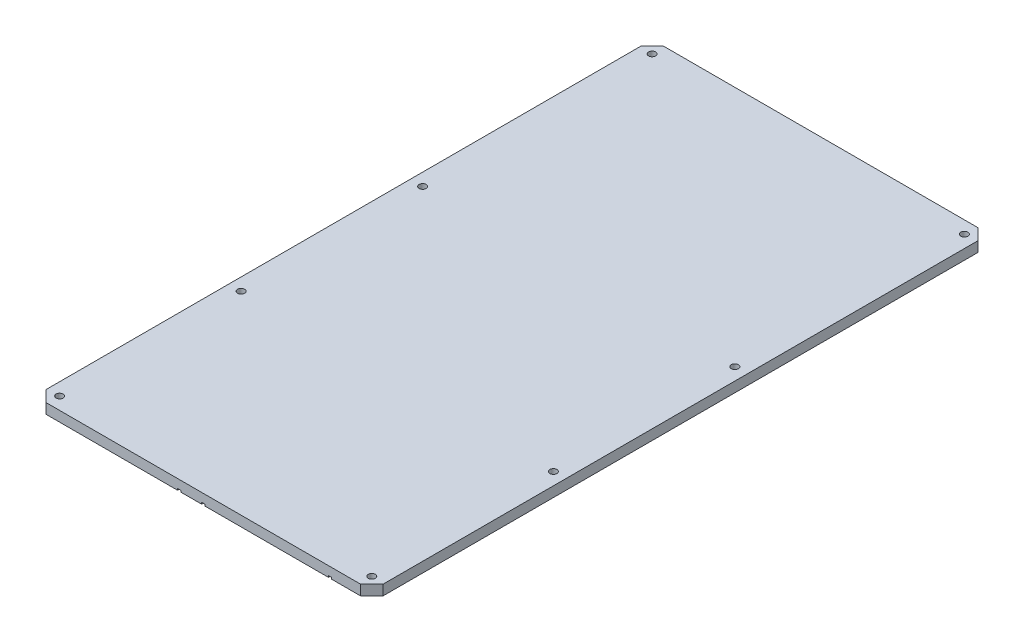
from build123d import *

# Parameters (mm, degrees)
SKETCH1_W               = 105
SKETCH1_H               = 192.3454
BOSS_EXTRUDE1_DEPTH     = 3.175
CHAMFER1_SIZE           = 3.5
SKETCH2_R               = 25
CUT_EXTRUDE1_DEPTH      = 110.615322151
CUT_EXTRUDE_THIN1_START = -0.5
CUT_EXTRUDE_THIN1_DEPTH = 0.5
CUT_EXTRUDE2_DEPTH      = 0.5
SKETCH6_R               = 1.1
CUT_EXTRUDE3_DEPTH      = 110.615322151
CHAMFER2_SIZE           = 1.1
SKETCH7_R               = 25
BOSS_EXTRUDE2_DEPTH     = 3.175
SKETCH7_3_W             = 4
SKETCH7_3_H             = 2
CUT_EXTRUDE4_DEPTH      = 0.5
FILLET1_R               = 0.5


# Read off the part's stored shape, not the designer's step: Cut-Extrude-Thin1
with BuildPart() as part:
    # Sketch1 → Boss-Extrude1 (new body)
    with BuildSketch(Plane(origin=(0, 0, 0), x_dir=(1, 0, 0), z_dir=(0, 1, 0))):
        Rectangle(SKETCH1_W, SKETCH1_H)
    extrude(amount=BOSS_EXTRUDE1_DEPTH)

    # Chamfer1
    chamfer1_edges = [part.edges().sort_by_distance(p)[0] for p in [
        (-52.5, 1.5875, -96.1727),
        (52.5, 1.5875, -96.1727),
        (52.5, 1.5875, 96.1727),
        (-52.5, 1.5875, 96.1727),
    ]]
    chamfer(chamfer1_edges, length=CHAMFER1_SIZE)

    # Sketch2 → Cut-Extrude1 (cut, through all)
    with BuildSketch(Plane.XZ):
        with Locations(Location((0, -32.057566667, 0), (0, 0, 270))):
            Circle(SKETCH2_R)
    extrude(amount=-CUT_EXTRUDE1_DEPTH, mode=Mode.SUBTRACT)

    # Cut-Extrude-Thin1 outline → Cut-Extrude-Thin1 (cut)
    # profile 1 of 2: a face of its own
    with BuildSketch(Plane(origin=(0, 0, 0), x_dir=(-1, 0, 0), z_dir=(0, -1, 0)).offset(CUT_EXTRUDE_THIN1_START)):
        with BuildLine():
            Line((-0.5, 7.062567167), (-0.5, -10.4787141))
            ThreePointArc((-0.5, -10.4787141), (-6.237149669, -19.303333464), (-7.980739941, -29.683539926))
            ThreePointArc((-7.980739941, -29.683539926), (0, -26.804235846), (7.980739941, -29.683539926))
            ThreePointArc((7.980739941, -29.683539926), (6.237149669, -19.303333464), (0.5, -10.4787141))
            Line((0.5, -10.4787141), (0.5, 7.062567167))
            ThreePointArc((0.5, 7.062567167), (0, 7.057566667), (-0.5, 7.062567167))
        make_face()
        with BuildLine():
            ThreePointArc((0, -11.397130906), (5.003923805, -18.927747814), (6.982377972, -27.750171719))
            ThreePointArc((6.982377972, -27.750171719), (0, -25.804235846), (-6.982377972, -27.750171719))
            ThreePointArc((-6.982377972, -27.750171719), (-5.003923805, -18.927747814), (0, -11.397130906))
        make_face(mode=Mode.SUBTRACT)
    # profile 2 of 2: a face of its own
    with BuildSketch(Plane(origin=(0, 0, 0), x_dir=(-1, 0, 0), z_dir=(0, -1, 0)).offset(CUT_EXTRUDE_THIN1_START)):
        with BuildLine():
            ThreePointArc((-3.461538462, -73.83767702), (-2.032623324, -72.965633547), (-0.5, -72.292340123))
            Line((-0.5, -72.292340123), (-0.5, -96.1727))
            Line((-0.5, -96.1727), (0.5, -96.1727))
            Line((0.5, -96.1727), (0.5, -89.050988889))
            Line((0.5, -89.050988889), (5.5, -89.050988889))
            Line((5.5, -89.050988889), (5.5, -88.050988889))
            Line((5.5, -88.050988889), (0.5, -88.050988889))
            Line((0.5, -88.050988889), (0.5, -71.977550364))
            ThreePointArc((0.5, -71.977550364), (3.75, -71.547658069), (7, -71.977550364))
            Line((7, -71.977550364), (7, -96.1727))
            Line((7, -96.1727), (8, -96.1727))
            Line((8, -96.1727), (8, -81.550988889))
            Line((8, -81.550988889), (32.5, -81.550988889))
            Line((32.5, -81.550988889), (32.5, 13.3273))
            Line((32.5, 13.3273), (39, 13.3273))
            Line((39, 13.3273), (39, -88.050988889))
            Line((39, -88.050988889), (9.5, -88.050988889))
            Line((9.5, -88.050988889), (9.5, -89.050988889))
            Line((9.5, -89.050988889), (40, -89.050988889))
            Line((40, -89.050988889), (40, 13.3273))
            Line((40, 13.3273), (43.75, 13.3273))
            Line((43.75, 13.3273), (43.75, 24.3273))
            ThreePointArc((43.75, 24.3273), (41.580951895, 29.804525575), (36.25, 32.311659711))
            Line((36.25, 32.311659711), (36.25, 63.444142327))
            Line((36.25, 63.444142327), (4.25, 63.444142327))
            Line((4.25, 63.444142327), (4.25, 68.752070988))
            ThreePointArc((4.25, 68.752070988), (6.207809813, 67.846319731), (7.980739941, 66.617448963))
            ThreePointArc((7.980739941, 66.617448963), (6.237149669, 76.997655425), (0.5, 85.822274789))
            Line((0.5, 85.822274789), (0.5, 96.1727))
            Line((0.5, 96.1727), (-0.5, 96.1727))
            Line((-0.5, 96.1727), (-0.5, 85.822274789))
            ThreePointArc((-0.5, 85.822274789), (-6.237149669, 76.997655425), (-7.980739941, 66.617448963))
            ThreePointArc((-7.980739941, 66.617448963), (-6.207809813, 67.846319731), (-4.25, 68.752070988))
            Line((-4.25, 68.752070988), (-4.25, 63.444142327))
            Line((-4.25, 63.444142327), (-36.25, 63.444142327))
            Line((-36.25, 63.444142327), (-36.25, 32.311659711))
            ThreePointArc((-36.25, 32.311659711), (-41.580951895, 29.804525575), (-43.75, 24.3273))
            Line((-43.75, 24.3273), (-43.75, 13.3273))
            Line((-43.75, 13.3273), (-40, 13.3273))
            Line((-40, 13.3273), (-40, -96.1727))
            Line((-40, -96.1727), (-39, -96.1727))
            Line((-39, -96.1727), (-39, -38.185855556))
            Line((-39, -38.185855556), (-3.25, -38.185855556))
            Line((-3.25, -38.185855556), (-3.25, -29.234128142))
            ThreePointArc((-3.25, -29.234128142), (0, -28.804235846), (3.25, -29.234128142))
            Line((3.25, -29.234128142), (3.25, -44.685855556))
            Line((3.25, -44.685855556), (-31.5, -44.685855556))
            Line((-31.5, -44.685855556), (-31.5, -39.685855556))
            Line((-31.5, -39.685855556), (-32.5, -39.685855556))
            Line((-32.5, -39.685855556), (-32.5, -45.685855556))
            Line((-32.5, -45.685855556), (3.25, -45.685855556))
            Line((3.25, -45.685855556), (3.25, -53.222136322))
            ThreePointArc((3.25, -53.222136322), (-2.487149669, -62.046755686), (-4.230739941, -72.426962148))
            ThreePointArc((-4.230739941, -72.426962148), (3.75, -69.547658069), (11.730739941, -72.426962148))
            ThreePointArc((11.730739941, -72.426962148), (9.987149669, -62.046755686), (4.25, -53.222136322))
            Line((4.25, -53.222136322), (4.25, -29.548917901))
            ThreePointArc((4.25, -29.548917901), (5.782623324, -30.222211325), (7.211538462, -31.094254798))
            Line((7.211538462, -31.094254798), (7.788461538, -30.277456314))
            ThreePointArc((7.788461538, -30.277456314), (0, -27.804235846), (-7.788461538, -30.277456314))
            Line((-7.788461538, -30.277456314), (-7.211538462, -31.094254798))
            ThreePointArc((-7.211538462, -31.094254798), (-5.782623324, -30.222211325), (-4.25, -29.548917901))
            Line((-4.25, -29.548917901), (-4.25, -37.185855556))
            Line((-4.25, -37.185855556), (-39, -37.185855556))
            Line((-39, -37.185855556), (-39, 13.3273))
            Line((-39, 13.3273), (-32.5, 13.3273))
            Line((-32.5, 13.3273), (-32.5, -35.685855556))
            Line((-32.5, -35.685855556), (-31.5, -35.685855556))
            Line((-31.5, -35.685855556), (-31.5, 13.3273))
            Line((-31.5, 13.3273), (-27.75, 13.3273))
            Line((-27.75, 13.3273), (-27.75, 24.3273))
            ThreePointArc((-27.75, 24.3273), (-29.919048105, 29.804525575), (-35.25, 32.311659711))
            Line((-35.25, 32.311659711), (-35.25, 62.444142327))
            Line((-35.25, 62.444142327), (-3.25, 62.444142327))
            Line((-3.25, 62.444142327), (-3.25, 69.066860747))
            ThreePointArc((-3.25, 69.066860747), (0, 69.496753043), (3.25, 69.066860747))
            Line((3.25, 69.066860747), (3.25, 62.444142327))
            Line((3.25, 62.444142327), (35.25, 62.444142327))
            Line((35.25, 62.444142327), (35.25, 32.311659711))
            ThreePointArc((35.25, 32.311659711), (29.919048105, 29.804525575), (27.75, 24.3273))
            Line((27.75, 24.3273), (27.75, 13.3273))
            Line((27.75, 13.3273), (31.5, 13.3273))
            Line((31.5, 13.3273), (31.5, -80.550988889))
            Line((31.5, -80.550988889), (8, -80.550988889))
            Line((8, -80.550988889), (8, -72.292340123))
            ThreePointArc((8, -72.292340123), (9.532623324, -72.965633547), (10.961538462, -73.83767702))
            Line((10.961538462, -73.83767702), (11.538461538, -73.020878536))
            ThreePointArc((11.538461538, -73.020878536), (3.75, -70.547658069), (-4.038461538, -73.020878536))
            Line((-4.038461538, -73.020878536), (-3.461538462, -73.83767702))
        make_face()
        with BuildLine():
            ThreePointArc((3.75, -54.140553128), (8.753923805, -61.671170036), (10.732377972, -70.493593942))
            ThreePointArc((10.732377972, -70.493593942), (3.75, -68.547658069), (-3.232377972, -70.493593942))
            ThreePointArc((-3.232377972, -70.493593942), (-1.253923805, -61.671170036), (3.75, -54.140553128))
        make_face(mode=Mode.SUBTRACT)
        with BuildLine():
            Line((-28.75, 14.3273), (-42.75, 14.3273))
            Line((-42.75, 14.3273), (-42.75, 24.3273))
            ThreePointArc((-42.75, 24.3273), (-35.75, 31.3273), (-28.75, 24.3273))
            Line((-28.75, 24.3273), (-28.75, 14.3273))
        make_face(mode=Mode.SUBTRACT)
        with BuildLine():
            ThreePointArc((28.75, 24.3273), (35.75, 31.3273), (42.75, 24.3273))
            Line((42.75, 24.3273), (42.75, 14.3273))
            Line((42.75, 14.3273), (28.75, 14.3273))
            Line((28.75, 14.3273), (28.75, 24.3273))
        make_face(mode=Mode.SUBTRACT)
        with BuildLine():
            ThreePointArc((0, 84.903857983), (5.003923805, 77.373241075), (6.982377972, 68.55081717))
            ThreePointArc((6.982377972, 68.55081717), (0, 70.496753043), (-6.982377972, 68.55081717))
            ThreePointArc((-6.982377972, 68.55081717), (-5.003923805, 77.373241075), (0, 84.903857983))
        make_face(mode=Mode.SUBTRACT)
    extrude(amount=CUT_EXTRUDE_THIN1_DEPTH, mode=Mode.SUBTRACT)

    # Sketch4 → Cut-Extrude2 (cut)
    with BuildSketch(Plane.XZ):
        with BuildLine():
            Line((-10.5, 88.050988889), (-9.5, 88.050988889))
            ThreePointArc((-9.5, 88.050988889), (-7.5, 86.050988889), (-5.5, 88.050988889))
            Line((-5.5, 88.050988889), (-4.5, 88.050988889))
            ThreePointArc((-4.5, 88.050988889), (-7.5, 85.050988889), (-10.5, 88.050988889))
        make_face()
        with BuildLine():
            Line((31.5, 35.685855556), (31.5, 34.685855556))
            ThreePointArc((31.5, 34.685855556), (28.5, 37.685855556), (31.5, 40.685855556))
            Line((31.5, 40.685855556), (31.5, 39.685855556))
            ThreePointArc((31.5, 39.685855556), (29.5, 37.685855556), (31.5, 35.685855556))
        make_face()
    extrude(amount=-CUT_EXTRUDE2_DEPTH, mode=Mode.SUBTRACT)

    # Sketch6 → Cut-Extrude3 (cut, through all)
    with BuildSketch(Plane.XZ):
        with Locations(Location((48.628679656, -20.801379656, 0), (0, 0, 270))):
            Circle(SKETCH6_R)
        with Locations(Location((-48.628679656, 92.301379656, 0), (0, 0, 270))):
            Circle(SKETCH6_R)
        with Locations(Location((-48.628679656, 35.75, 0), (0, 0, 270))):
            Circle(SKETCH6_R)
        with Locations(Location((-48.628679656, -20.801379656, 0), (0, 0, 270))):
            Circle(SKETCH6_R)
        with Locations(Location((-48.628679656, -92.301379656, 0), (0, 0, 270))):
            Circle(SKETCH6_R)
        with Locations(Location((48.628679656, -92.301379656, 0), (0, 0, 270))):
            Circle(SKETCH6_R)
        with Locations(Location((48.628679656, 35.75, 0), (0, 0, 270))):
            Circle(SKETCH6_R)
        with Locations(Location((48.628679656, 92.301379656, 0), (0, 0, 270))):
            Circle(SKETCH6_R)
    extrude(amount=-CUT_EXTRUDE3_DEPTH, mode=Mode.SUBTRACT)

    # Chamfer2
    chamfer2_edges = [part.edges().sort_by_distance(p)[0] for p in [
        (48.628679656, 0, 93.401379656),
        (48.628679656, 0, 36.85),
        (48.628679656, 0, -91.201379656),
        (-48.628679656, 0, -91.201379656),
        (-48.628679656, 0, -19.701379656),
        (-48.628679656, 0, 36.85),
        (-48.628679656, 0, 93.401379656),
        (48.628679656, 0, -19.701379656),
    ]]
    chamfer(chamfer2_edges, length=CHAMFER2_SIZE)

    # Sketch7 → Boss-Extrude2 (add)
    with BuildSketch(Plane.XZ):
        with Locations((0, -32.057566667)):
            Circle(SKETCH7_R)
    extrude(amount=-BOSS_EXTRUDE2_DEPTH)

    # Sketch7<3> → Cut-Extrude4 (cut)
    with BuildSketch(Plane.XZ):
        with BuildLine():
            Line((-18.5, -21.346241801), (-18.5, -32.557566667))
            Line((-18.5, -32.557566667), (-14.066789269, -32.557566667))
            Line((-14.066789269, -32.557566667), (0.798198495, -36.60100128))
            Line((0.798198495, -36.60100128), (6.655813125, -32.557566667))
            Line((6.655813125, -32.557566667), (9.5, -32.557566667))
            Line((9.5, -32.557566667), (9.5, -28.557566667))
            Line((9.5, -28.557566667), (3.5, -28.557566667))
            Line((3.5, -28.557566667), (3.5, -31.557566667))
            Line((3.5, -31.557566667), (0.5, -31.557566667))
            Line((0.5, -31.557566667), (0.5, -7.062567167))
            ThreePointArc((0.5, -7.062567167), (0, -7.057566667), (-0.5, -7.062567167))
            Line((-0.5, -7.062567167), (-0.5, -31.557566667))
            Line((-0.5, -31.557566667), (-17.5, -31.557566667))
            Line((-17.5, -31.557566667), (-17.5, -21.92359207))
            Line((-17.5, -21.92359207), (-15.767949192, -22.92359207))
            Line((-15.767949192, -22.92359207), (-15.767949192, -20.557566667))
            Line((-15.767949192, -20.557566667), (-12.267949192, -20.557566667))
            Line((-12.267949192, -20.557566667), (-12.267949192, -19.557566667))
            Line((-12.267949192, -19.557566667), (-15.767949192, -19.557566667))
            Line((-15.767949192, -19.557566667), (-15.767949192, -17.191541263))
            Line((-15.767949192, -17.191541263), (-19.232050808, -19.191541263))
            Line((-19.232050808, -19.191541263), (-19.232050808, -17.191541263))
            Line((-19.232050808, -17.191541263), (-20.232050808, -17.191541263))
            Line((-20.232050808, -17.191541263), (-20.232050808, -19.557566667))
            Line((-20.232050808, -19.557566667), (-23.732050808, -19.557566667))
            Line((-23.732050808, -19.557566667), (-23.732050808, -20.557566667))
            Line((-23.732050808, -20.557566667), (-20.232050808, -20.557566667))
            Line((-20.232050808, -20.557566667), (-20.232050808, -22.92359207))
            Line((-20.232050808, -22.92359207), (-19.232050808, -22.92359207))
            Line((-19.232050808, -22.92359207), (-19.232050808, -20.92359207))
            Line((-19.232050808, -20.92359207), (-18.5, -21.346241801))
        make_face()
        Polygon((-10.25688375, -32.557566667), (-0.419549816, -32.557566667), (0.076046582, -35.368233505), align=None, mode=Mode.SUBTRACT)
        Polygon((0.595876796, -32.557566667), (4.895513856, -32.557566667), (1.062425732, -35.203497165), align=None, mode=Mode.SUBTRACT)
        with Locations((6.5, -30.557566667)):
            Rectangle(SKETCH7_3_W, SKETCH7_3_H, mode=Mode.SUBTRACT)
    extrude(amount=-CUT_EXTRUDE4_DEPTH, mode=Mode.SUBTRACT)

    # Fillet1
    fillet1_edges = [part.edges().sort_by_distance(p)[0] for p in [
        (-3.25, 0.25, -62.444142327),
        (3.25, 0.25, -62.444142327),
        (32.5, 0.25, 35.685855556),
        (32.5, 0.25, 45.685855556),
        (-7.980739941, 0.25, -66.617448963),
        (7.980739941, 0.25, -66.617448963),
        (-27.75, 0.25, -13.3273),
        (-43.75, 0.25, -13.3273),
        (-32.5, 0.25, 81.550988889),
        (-40, 0.25, 89.050988889),
        (-9.5, 0.25, 89.050988889),
        (-5.5, 0.25, 89.050988889),
        (4.230739941, 0.25, 72.426962148),
        (4.038461538, 0.25, 73.020878536),
        (3.461538462, 0.25, 73.83767702),
        (-11.538461538, 0.25, 73.020878536),
        (-10.961538462, 0.25, 73.83767702),
        (-11.730739941, 0.25, 72.426962148),
        (3.25, 0.25, 38.185855556),
        (-7.788461538, 0.25, 30.277456314),
        (-7.211538462, 0.25, 31.094254798),
        (-7.980739941, 0.25, 29.683539926),
        (7.788461538, 0.25, 30.277456314),
        (7.211538462, 0.25, 31.094254798),
        (7.980739941, 0.25, 29.683539926),
        (0.798198495, 0.25, -36.60100128),
        (-18.5, 0.25, -32.557566667),
        (-23.732050808, 0.25, -19.557566667),
        (-23.732050808, 0.25, -20.557566667),
        (-20.232050808, 0.25, -22.92359207),
        (-19.232050808, 0.25, -22.92359207),
        (-20.232050808, 0.25, -17.191541263),
        (-19.232050808, 0.25, -17.191541263),
        (-15.767949192, 0.25, -22.92359207),
        (-15.767949192, 0.25, -17.191541263),
        (-12.267949192, 0.25, -20.557566667),
        (-12.267949192, 0.25, -19.557566667),
        (3.5, 0.25, -28.557566667),
        (9.5, 0.25, -32.557566667),
        (9.5, 0.25, -28.557566667),
        (27.75, 0.25, -13.3273),
        (43.75, 0.25, -13.3273),
        (32.5, 0.25, 39.685855556),
        (-36.25, 0.25, -63.444142327),
    ]]
    fillet(fillet1_edges, radius=FILLET1_R - 0.0001)  # a hair under: the kernel refuses the full size


solid = part.part
